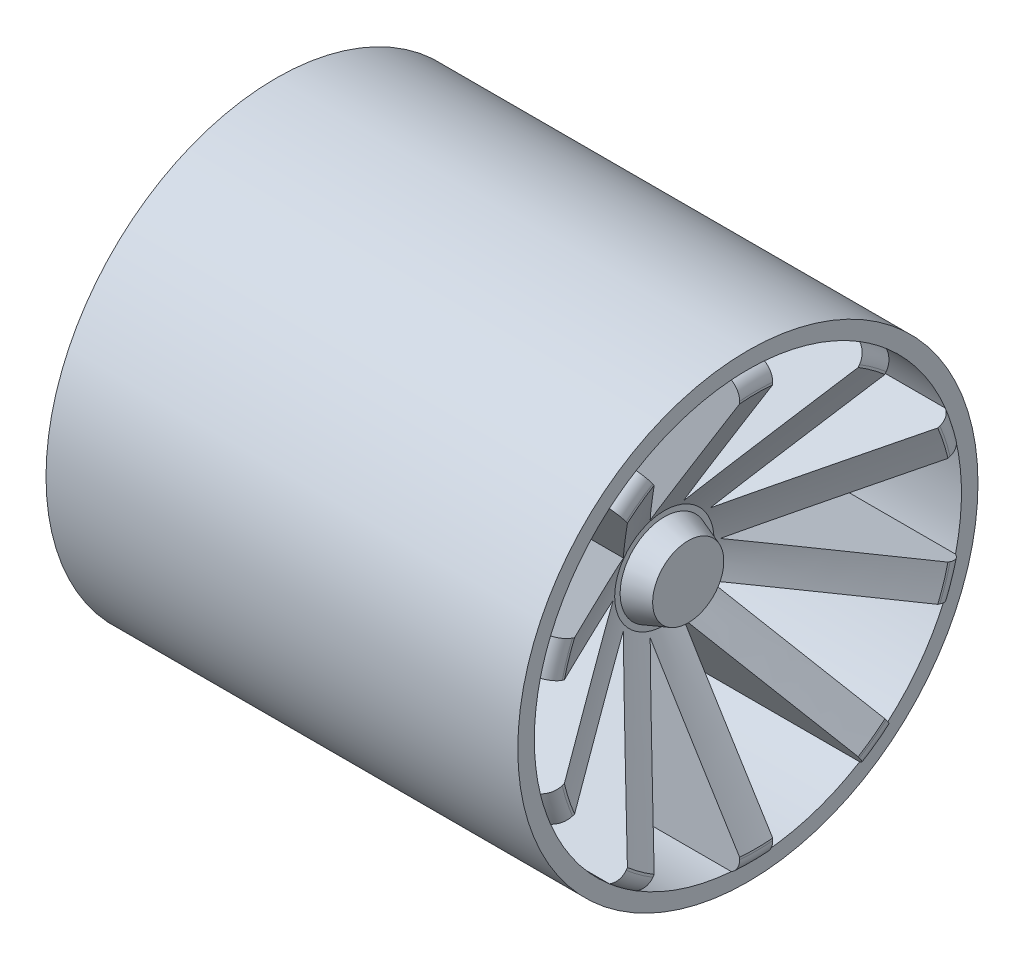
from build123d import *

# Parameters (mm, degrees)
CUT_EXTRUDE1_DEPTH      = 36.034554371
CUT_EXTRUDE1_DEPTH_BACK = 36.034554371
FILLET2_R               = 1


with BuildPart() as part:
    # Sketch1 → Revolve1 (revolve)
    with BuildSketch(Plane(origin=(0, 0, 0), x_dir=(1, 0, 0), z_dir=(0, 1, 0)), mode=Mode.PRIVATE) as revolve1_sk:
        Polygon((-14.5, 13.9), (14, 13.9), (14, 12.9), (14.5, 12.9), (14.5, 11.9), (8.952296079, 3), (8.952296079, 2.671610604), (10.394900615, 2.149459175), (10.394900615, 0), (8.952296079, 0), (1.974024902, 0), (-6.573004912, 0), (-6.573004912, 1.6), (-11.874327201, 1.6), (-11.874327201, 3.6), (-6.23909958, 3.6), (-6.23909958, 12.9), (-14.5, 12.9), align=None)
    revolve(revolve1_sk.sketch.rotate(Axis((-25, 0, 0), (1, 0, 0)), 180), axis=Axis((-25, 0, 0), (1, 0, 0)))

    # Sketch2 → Cut-Extrude1 (cut, two sides: drawn at the far end of the back side and taken through both)
    with BuildSketch(Plane(origin=(14.5, 0, 0), x_dir=(0, 0, -1), z_dir=(1, 0, 0)).offset(-CUT_EXTRUDE1_DEPTH_BACK)):
        with BuildLine():
            Line((-1, 3.077683537), (-1, 12.861181905))
            ThreePointArc((-1, 12.861181905), (-3.986319227, 12.26862906), (-6.750596057, 10.992699981))
            Line((-6.750596057, 10.992699981), (-1, 3.077683537))
        make_face()
        with BuildLine():
            Line((1, 12.861181905), (1, 3.077683537))
            Line((1, 3.077683537), (6.750596057, 10.992699981))
            ThreePointArc((6.750596057, 10.992699981), (3.986319227, 12.26862906), (1, 12.861181905))
        make_face()
        with BuildLine():
            Line((8.368630045, 9.817129477), (2.618033989, 1.902113033))
            Line((2.618033989, 1.902113033), (11.922693864, 4.925380293))
            ThreePointArc((11.922693864, 4.925380293), (10.436319227, 7.582429755), (8.368630045, 9.817129477))
        make_face()
        with BuildLine():
            Line((12.540727853, 3.02326726), (3.236067977, 0))
            Line((3.236067977, 0), (12.540727853, -3.02326726))
            ThreePointArc((12.540727853, -3.02326726), (12.9, 0), (12.540727853, 3.02326726))
        make_face()
        with BuildLine():
            Line((11.922693864, -4.925380293), (2.618033989, -1.902113033))
            Line((2.618033989, -1.902113033), (8.368630045, -9.817129477))
            ThreePointArc((8.368630045, -9.817129477), (10.436319227, -7.582429755), (11.922693864, -4.925380293))
        make_face()
        with BuildLine():
            Line((6.750596057, -10.992699981), (1, -3.077683537))
            Line((1, -3.077683537), (1, -12.861181905))
            ThreePointArc((1, -12.861181905), (3.986319227, -12.26862906), (6.750596057, -10.992699981))
        make_face()
        with BuildLine():
            Line((-1, -12.861181905), (-1, -3.077683537))
            Line((-1, -3.077683537), (-6.750596057, -10.992699981))
            ThreePointArc((-6.750596057, -10.992699981), (-3.986319227, -12.26862906), (-1, -12.861181905))
        make_face()
        with BuildLine():
            Line((-8.368630045, -9.817129477), (-2.618033989, -1.902113033))
            Line((-2.618033989, -1.902113033), (-11.922693864, -4.925380293))
            ThreePointArc((-11.922693864, -4.925380293), (-10.436319227, -7.582429755), (-8.368630045, -9.817129477))
        make_face()
        with BuildLine():
            Line((-12.540727853, -3.02326726), (-3.236067977, 0))
            Line((-3.236067977, 0), (-12.540727853, 3.02326726))
            ThreePointArc((-12.540727853, 3.02326726), (-12.9, 0), (-12.540727853, -3.02326726))
        make_face()
        with BuildLine():
            Line((-11.922693864, 4.925380293), (-2.618033989, 1.902113033))
            Line((-2.618033989, 1.902113033), (-8.368630045, 9.817129477))
            ThreePointArc((-8.368630045, 9.817129477), (-10.436319227, 7.582429755), (-11.922693864, 4.925380293))
        make_face()
    extrude(amount=CUT_EXTRUDE1_DEPTH + CUT_EXTRUDE1_DEPTH_BACK, mode=Mode.SUBTRACT)

    # Fillet2
    # the kernel refuses this fillet: 1 mm, written as the material it takes off along each edge
    with BuildSketch(Plane(origin=(14.5, 0, 0), x_dir=(0, 0.9275901950191912, 0.3735992908240845), z_dir=(0, 0.3735992908240845, -0.9275901950191912))) as fillet2_piece_1:
        with BuildLine():
            CenterArc((12.033974596, -1), FILLET2_R, 30, 60)
            Line((12.9, -0.5), (12.917320508, -0.49))
            ThreePointArc((12.917320508, -0.49), (12.92, -0.25), (12.92, 0))
            Line((12.92, 0), (12.9, 0.02))
            Line((12.9, 0.02), (12.033974596, 0.02))
            Line((12.033974596, 0.02), (12.033974596, 0))
        make_face()
    revolve(axis=Axis((14.5, 0, 0), (1, 0, 0)), revolution_arc=28.124466226, mode=Mode.SUBTRACT)
    with BuildSketch(Plane(origin=(14.5, 0, 0), x_dir=(0, 0.5308400781727377, 0.847472012166515), z_dir=(0, 0.847472012166515, -0.5308400781727377))) as fillet2_piece_2:
        with BuildLine():
            CenterArc((12.033974596, -1), FILLET2_R, 30, 60)
            Line((12.9, -0.5), (12.917320508, -0.49))
            ThreePointArc((12.917320508, -0.49), (12.92, -0.25), (12.92, 0))
            Line((12.92, 0), (12.9, 0.02))
            Line((12.9, 0.02), (12.033974596, 0.02))
            Line((12.033974596, 0.02), (12.033974596, 0))
        make_face()
    revolve(axis=Axis((14.5, 0, 0), (1, 0, 0)), revolution_arc=28.124466226, mode=Mode.SUBTRACT)
    with BuildSketch(Plane(origin=(14.5, 0, 0), x_dir=(0, -0.06867290594503737, 0.9976392293755614), z_dir=(0, 0.9976392293755614, 0.06867290594503737))) as fillet2_piece_3:
        with BuildLine():
            CenterArc((12.033974596, -1), FILLET2_R, 30, 60)
            Line((12.033974596, 0), (12.033974596, 0.02))
            Line((12.033974596, 0.02), (12.9, 0.02))
            Line((12.9, 0.02), (12.92, 0))
            ThreePointArc((12.92, 0), (12.92, -0.25), (12.917320508, -0.49))
            Line((12.917320508, -0.49), (12.9, -0.5))
        make_face()
    revolve(axis=Axis((14.5, 0, 0), (1, 0, 0)), revolution_arc=28.124466226, mode=Mode.SUBTRACT)
    with BuildSketch(Plane(origin=(14.5, 0, 0), x_dir=(0, -0.6419551740979961, 0.7667421694734232), z_dir=(0, 0.7667421694734232, 0.6419551740979961))) as fillet2_piece_4:
        with BuildLine():
            CenterArc((12.033974596, -1), FILLET2_R, 30, 60)
            Line((12.9, -0.5), (12.917320508, -0.49))
            ThreePointArc((12.917320508, -0.49), (12.92, -0.25), (12.92, 0))
            Line((12.92, 0), (12.9, 0.02))
            Line((12.9, 0.02), (12.033974596, 0.02))
            Line((12.033974596, 0.02), (12.033974596, 0))
        make_face()
    revolve(axis=Axis((14.5, 0, 0), (1, 0, 0)), revolution_arc=28.124466226, mode=Mode.SUBTRACT)
    with BuildSketch(Plane(origin=(14.5, 0, 0), x_dir=(0, -0.9700323849994236, 0.2429756614402568), z_dir=(0, 0.2429756614402568, 0.9700323849994236))) as fillet2_piece_5:
        with BuildLine():
            CenterArc((12.033974596, -1), FILLET2_R, 30, 60)
            Line((12.9, -0.5), (12.917320508, -0.49))
            ThreePointArc((12.917320508, -0.49), (12.92, -0.25), (12.92, 0))
            Line((12.92, 0), (12.9, 0.02))
            Line((12.9, 0.02), (12.033974596, 0.02))
            Line((12.033974596, 0.02), (12.033974596, 0))
        make_face()
    revolve(axis=Axis((14.5, 0, 0), (1, 0, 0)), revolution_arc=28.124466226, mode=Mode.SUBTRACT)
    with BuildSketch(Plane(origin=(14.5, 0, 0), x_dir=(0, -0.9275901950191969, -0.3735992908240703), z_dir=(0, -0.3735992908240703, 0.9275901950191969))) as fillet2_piece_6:
        with BuildLine():
            CenterArc((12.033974596, -1), FILLET2_R, 30, 60)
            Line((12.9, -0.5), (12.917320508, -0.49))
            ThreePointArc((12.917320508, -0.49), (12.92, -0.25), (12.92, 0))
            Line((12.92, 0), (12.9, 0.02))
            Line((12.9, 0.02), (12.033974596, 0.02))
            Line((12.033974596, 0.02), (12.033974596, 0))
        make_face()
    revolve(axis=Axis((14.5, 0, 0), (1, 0, 0)), revolution_arc=28.124466226, mode=Mode.SUBTRACT)
    with BuildSketch(Plane(origin=(14.5, 0, 0), x_dir=(0, -0.5308400781727858, -0.8474720121664848), z_dir=(0, -0.8474720121664848, 0.5308400781727858))) as fillet2_piece_7:
        with BuildLine():
            CenterArc((12.033974596, -1), FILLET2_R, 30, 60)
            Line((12.9, -0.5), (12.917320508, -0.49))
            ThreePointArc((12.917320508, -0.49), (12.92, -0.25), (12.92, 0))
            Line((12.92, 0), (12.9, 0.02))
            Line((12.9, 0.02), (12.033974596, 0.02))
            Line((12.033974596, 0.02), (12.033974596, 0))
        make_face()
    revolve(axis=Axis((14.5, 0, 0), (1, 0, 0)), revolution_arc=28.124466226, mode=Mode.SUBTRACT)
    with BuildSketch(Plane(origin=(14.5, 0, 0), x_dir=(0, 0.06867290594500228, -0.9976392293755638), z_dir=(0, -0.9976392293755638, -0.06867290594500228))) as fillet2_piece_8:
        with BuildLine():
            CenterArc((12.033974596, -1), FILLET2_R, 30, 60)
            Line((12.9, -0.5), (12.917320508, -0.49))
            ThreePointArc((12.917320508, -0.49), (12.92, -0.25), (12.92, 0))
            Line((12.92, 0), (12.9, 0.02))
            Line((12.9, 0.02), (12.033974596, 0.02))
            Line((12.033974596, 0.02), (12.033974596, 0))
        make_face()
    revolve(axis=Axis((14.5, 0, 0), (1, 0, 0)), revolution_arc=28.124466226, mode=Mode.SUBTRACT)
    with BuildSketch(Plane(origin=(14.5, 0, 0), x_dir=(0, 0.6419551740980098, -0.7667421694734116), z_dir=(0, -0.7667421694734116, -0.6419551740980098))) as fillet2_piece_9:
        with BuildLine():
            CenterArc((12.033974596, -1), FILLET2_R, 30, 60)
            Line((12.9, -0.5), (12.917320508, -0.49))
            ThreePointArc((12.917320508, -0.49), (12.92, -0.25), (12.92, 0))
            Line((12.92, 0), (12.9, 0.02))
            Line((12.9, 0.02), (12.033974596, 0.02))
            Line((12.033974596, 0.02), (12.033974596, 0))
        make_face()
    revolve(axis=Axis((14.5, 0, 0), (1, 0, 0)), revolution_arc=28.124466226, mode=Mode.SUBTRACT)
    with BuildSketch(Plane(origin=(14.5, 0, 0), x_dir=(0, 0.9700323849994166, -0.242975661440284), z_dir=(0, -0.242975661440284, -0.9700323849994166))) as fillet2_piece_10:
        with BuildLine():
            CenterArc((12.033974596, -1), FILLET2_R, 30, 60)
            Line((12.9, -0.5), (12.917320508, -0.49))
            ThreePointArc((12.917320508, -0.49), (12.92, -0.25), (12.92, 0))
            Line((12.92, 0), (12.9, 0.02))
            Line((12.9, 0.02), (12.033974596, 0.02))
            Line((12.033974596, 0.02), (12.033974596, 0))
        make_face()
    revolve(axis=Axis((14.5, 0, 0), (1, 0, 0)), revolution_arc=28.124466226, mode=Mode.SUBTRACT)


solid = part.part
